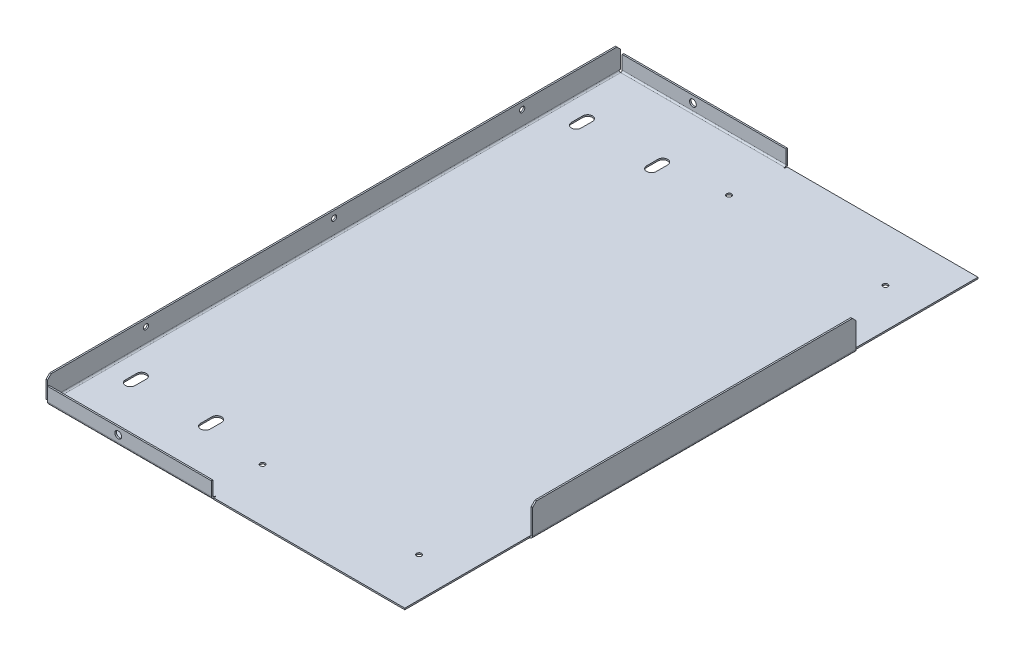
from build123d import *

# Parameters (mm, degrees)
SM_BASE_FLANGE_1_DEPTH   = 381
SKETCH_6_R               = 3.5
CUT_EXTRUDE_1_DEPTH      = 10
SKETCH_7_R               = 3.25
CUT_EXTRUDE_2_DEPTH      = 10
SM_EDGE_FLANGE_2_DEPTH   = 430
OTHER_START              = -2
OTHER_1_DEPTH            = 2
OTHER_START_2            = 477
OTHER_1_2_DEPTH          = 2
SM_START                 = -2
SM_EDGE_FLANGE_4_DEPTH   = 223
SM_EDGE_FLANGE_4_2_DEPTH = 4
SM_START_2               = 220
SM_EDGE_FLANGE_4_3_DEPTH = 1
SM_START_3               = 2
SM_EDGE_FLANGE_4_4_DEPTH = 218
SKETCH_26_R              = 4.5
CUT_EXTRUDE_3_DEPTH      = 905.321292462
SKETCH_28_W              = 762
SKETCH_28_H              = 10
CUT_EXTRUDE_4_DEPTH      = 10
CHAMFER_1_SIZE           = 5


# Read off the part's stored shape, not the designer's step: Затупленный угол1, Ребро-кромка4
# Sheet-metal steps are written as plain solids
with BuildPart() as part:
    # Sketch 1 → Базовая кромка1 (new, symmetric)
    with BuildSketch(Plane.XY):
        with BuildLine():
            Line((0, 40), (0, 2))
            ThreePointArc((0, 2), (0.585786438, 0.585786438), (2, 0))
            Line((2, 0), (475, 0))
            Line((475, 0), (475, -2))
            Line((475, -2), (2, -2))
            ThreePointArc((2, -2), (-0.828427125, -0.828427125), (-2, 2))
            Line((-2, 2), (-2, 40))
            Line((-2, 40), (0, 40))
        make_face()
    extrude(amount=SM_BASE_FLANGE_1_DEPTH, both=True)

    # Эскиз6 → Вырез-Вытянуть1 (cut)
    with BuildSketch(Plane.ZY.offset(2)):
        with Locations(Location((-250, 21, 0), (0, 0, 270))):
            Circle(SKETCH_6_R)
        with Locations(Location((0, 21, 0), (0, 0, 270))):
            Circle(SKETCH_6_R)
        with Locations(Location((250, 21, 0), (0, 0, 270))):
            Circle(SKETCH_6_R)
    extrude(amount=-CUT_EXTRUDE_1_DEPTH, mode=Mode.SUBTRACT)

    # Эскиз7 → Вырез-Вытянуть2 (cut)
    with BuildSketch(Plane.XZ.offset(2)):
        with Locations(Location((215, -310, 0), (0, 0, 270))):
            Circle(SKETCH_7_R)
        with Locations(Location((215, 310, 0), (0, 0, 90))):
            Circle(SKETCH_7_R)
        with Locations(Location((423, -310, 0), (0, 0, 270))):
            Circle(SKETCH_7_R)
        with Locations(Location((423, 310, 0), (0, 0, 90))):
            Circle(SKETCH_7_R)
        with BuildLine():
            Line((26.5, -304), (26.5, -289))
            ThreePointArc((26.5, -289), (33, -282.5), (39.5, -289))
            Line((39.5, -289), (39.5, -304))
            ThreePointArc((39.5, -304), (33, -310.5), (26.5, -304))
        make_face()
        with BuildLine():
            Line((139.5, -289), (139.5, -304))
            ThreePointArc((139.5, -304), (133, -310.5), (126.5, -304))
            Line((126.5, -304), (126.5, -289))
            ThreePointArc((126.5, -289), (133, -282.5), (139.5, -289))
        make_face()
        with BuildLine():
            Line((26.5, 304), (26.5, 289))
            ThreePointArc((26.5, 289), (33, 282.5), (39.5, 289))
            Line((39.5, 289), (39.5, 304))
            ThreePointArc((39.5, 304), (33, 310.5), (26.5, 304))
        make_face()
        with BuildLine():
            Line((139.5, 289), (139.5, 304))
            ThreePointArc((139.5, 304), (133, 310.5), (126.5, 304))
            Line((126.5, 304), (126.5, 289))
            ThreePointArc((126.5, 289), (133, 282.5), (139.5, 289))
        make_face()
    extrude(amount=-CUT_EXTRUDE_2_DEPTH, mode=Mode.SUBTRACT)

    # Ребро-кромка2 section (across the edge) → Ребро-кромка2 (add)
    with BuildSketch(Plane(origin=(477, 0, 215), x_dir=(-1, 0, 0), z_dir=(0, 0, -1))):
        with BuildLine():
            Line((-2, 2), (-2, 40))
            Line((-2, 40), (0, 40))
            Line((0, 40), (0, 2))
            ThreePointArc((0, 2), (0.585786438, 0.585786438), (2, 0))
            Line((2, 0), (2, -2))
            ThreePointArc((2, -2), (-0.828427125, -0.828427125), (-2, 2))
        make_face()
    extrude(amount=SM_EDGE_FLANGE_2_DEPTH)

    # Other 1 outline → Other 1 (cut)
    with BuildSketch(Plane.YZ.offset(OTHER_START)):
        Polygon((40, -381), (40, -376), (35, -381), align=None)
        Polygon((35, 381), (40, 376), (40, 381), align=None)
    extrude(amount=OTHER_1_DEPTH, mode=Mode.SUBTRACT)

    # Other 1 2 outline → Other 1 2 (cut)
    with BuildSketch(Plane.YZ.offset(OTHER_START_2)):
        Polygon((35, 215), (40, 210), (40, 215), align=None)
        Polygon((35, -215), (40, -215), (40, -210), align=None)
    extrude(amount=OTHER_1_2_DEPTH, mode=Mode.SUBTRACT)

    # Ребро-кромка4 outline → Ребро-кромка4 (cut)
    with BuildSketch(Plane.YZ.offset(SM_START)):
        with BuildLine():
            ThreePointArc((0, -379), (0.585786438, -380.414213562), (2, -381))
            Line((2, -381), (2, -379))
            Line((2, -379), (0, -379))
        make_face()
        with BuildLine():
            ThreePointArc((-1.464101616, -381), (-1.863703305, -380.03527618), (-2, -379))
            Line((-2, -379), (-2, -381))
            Line((-2, -381), (-1.464101616, -381))
        make_face()
        with BuildLine():
            ThreePointArc((2, 381), (0.585786438, 380.414213562), (0, 379))
            Line((0, 379), (2, 379))
            Line((2, 379), (2, 381))
        make_face()
        with BuildLine():
            Line((-2, 381), (-2, 379))
            ThreePointArc((-2, 379), (-1.863703305, 380.03527618), (-1.464101616, 381))
            Line((-1.464101616, 381), (-2, 381))
        make_face()
    extrude(amount=SM_EDGE_FLANGE_4_DEPTH, mode=Mode.SUBTRACT)

    # Sm Edge Flange 4 2 outline → Sm Edge Flange 4 2 (cut)
    with BuildSketch(Plane.YZ.offset(SM_START)):
        with BuildLine():
            ThreePointArc((2, -381), (0.585786438, -380.414213562), (0, -379))
            Line((0, -379), (-2, -379))
            ThreePointArc((-2, -379), (-1.863703305, -380.03527618), (-1.464101616, -381))
            Line((-1.464101616, -381), (2, -381))
        make_face()
        with BuildLine():
            Line((2, 381), (-1.464101616, 381))
            ThreePointArc((-1.464101616, 381), (-1.863703305, 380.03527618), (-2, 379))
            Line((-2, 379), (0, 379))
            ThreePointArc((0, 379), (0.585786438, 380.414213562), (2, 381))
        make_face()
    extrude(amount=SM_EDGE_FLANGE_4_2_DEPTH, mode=Mode.SUBTRACT)

    # Sm Edge Flange 4 3 outline → Sm Edge Flange 4 3 (cut)
    with BuildSketch(Plane.YZ.offset(SM_START_2)):
        with BuildLine():
            Line((0, -381), (0, -378))
            Line((0, -378), (-2, -378))
            Line((-2, -378), (-2, -379))
            ThreePointArc((-2, -379), (-1.863703305, -380.03527618), (-1.464101616, -381))
            Line((-1.464101616, -381), (0, -381))
        make_face()
        with BuildLine():
            Line((-2, 378), (0, 378))
            Line((0, 378), (0, 381))
            Line((0, 381), (-1.464101616, 381))
            ThreePointArc((-1.464101616, 381), (-1.863703305, 380.03527618), (-2, 379))
            Line((-2, 379), (-2, 378))
        make_face()
    extrude(amount=SM_EDGE_FLANGE_4_3_DEPTH, mode=Mode.SUBTRACT)

    # Sm Edge Flange 4 4 outline → Sm Edge Flange 4 4 (add)
    with BuildSketch(Plane.YZ.offset(SM_START_3)):
        with BuildLine():
            Line((0, -379), (0, -381))
            Line((0, -381), (-1.464101616, -381))
            ThreePointArc((-1.464101616, -381), (0, -382.464101615), (2, -383))
            Line((2, -383), (20, -383))
            Line((20, -383), (20, -381))
            Line((20, -381), (2, -381))
            ThreePointArc((2, -381), (0.585786438, -380.414213562), (0, -379))
        make_face()
        with BuildLine():
            Line((0, 381), (0, 379))
            ThreePointArc((0, 379), (0.585786438, 380.414213562), (2, 381))
            Line((2, 381), (20, 381))
            Line((20, 381), (20, 383))
            Line((20, 383), (2, 383))
            ThreePointArc((2, 383), (0, 382.464101615), (-1.464101616, 381))
            Line((-1.464101616, 381), (0, 381))
        make_face()
    extrude(amount=SM_EDGE_FLANGE_4_4_DEPTH)

    # Эскиз26 → Вырез-Вытянуть3 (cut, through all)
    with BuildSketch(Plane(origin=(0, 0, -383), x_dir=(-1, 0, 0), z_dir=(0, 0, -1))):
        with Locations(Location((-96, 11, 0), (0, 0, 90))):
            Circle(SKETCH_26_R)
    extrude(amount=-CUT_EXTRUDE_3_DEPTH, mode=Mode.SUBTRACT)

    # Эскиз28 → Вырез-Вытянуть4 (cut)
    with BuildSketch(Plane.ZY.offset(2)):
        with Locations((0, 35)):
            Rectangle(SKETCH_28_W, SKETCH_28_H)
    extrude(amount=-CUT_EXTRUDE_4_DEPTH, mode=Mode.SUBTRACT)

    # Фаска1
    chamfer_1_edges = [part.edges().sort_by_distance(p)[0] for p in [
        (-1, 30, 381),
        (-1, 30, -381),
    ]]
    chamfer(chamfer_1_edges, length=CHAMFER_1_SIZE)


solid = part.part
